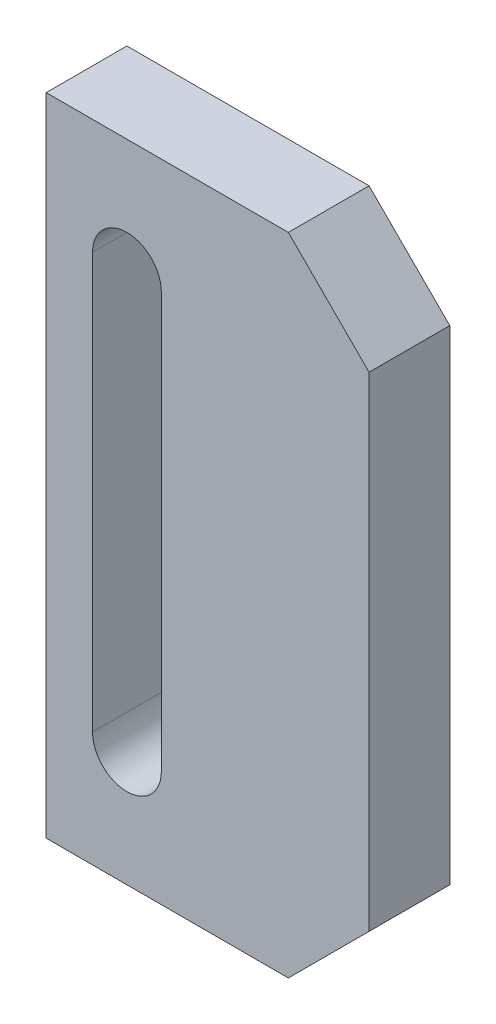
from build123d import *

# Parameters (mm, degrees)
SKETCH1_W                 = 12.7
SKETCH1_H                 = 25.4
BOSS_EXTRUDE1_DEPTH       = 3.175
CHAMFER1_SIZE             = 3.175
F_2_CLEARANCE_SLOT1_DEPTH = 3.175


# Read off the part's stored shape, not the designer's step: #2 Clearance Slot1
with BuildPart() as part:
    # Sketch1 → Boss-Extrude1 (new body)
    with BuildSketch(Plane.XY):
        with Locations((119.14748118, -2406.283004154)):
            Rectangle(SKETCH1_W, SKETCH1_H)
    extrude(amount=BOSS_EXTRUDE1_DEPTH)

    # Chamfer1
    chamfer1_edges = [part.edges().sort_by_distance(p)[0] for p in [
        (125.49748118, -2393.583004154, 1.5875),
        (125.49748118, -2418.983004154, 1.5875),
    ]]
    chamfer(chamfer1_edges, length=CHAMFER1_SIZE)

    # #2 Clearance Slot1 outline → #2 Clearance Slot1 (cut)
    with BuildSketch(Plane.XY):
        with BuildLine():
            Line((117.32503118, -2414.455454154), (117.32503118, -2398.110554154))
            ThreePointArc((117.32503118, -2398.110554154), (115.97248118, -2396.758004154), (114.61993118, -2398.110554154))
            Line((114.61993118, -2398.110554154), (114.61993118, -2414.455454154))
            ThreePointArc((114.61993118, -2414.455454154), (115.97248118, -2415.808004154), (117.32503118, -2414.455454154))
        make_face()
    extrude(amount=F_2_CLEARANCE_SLOT1_DEPTH, mode=Mode.SUBTRACT)


solid = part.part
